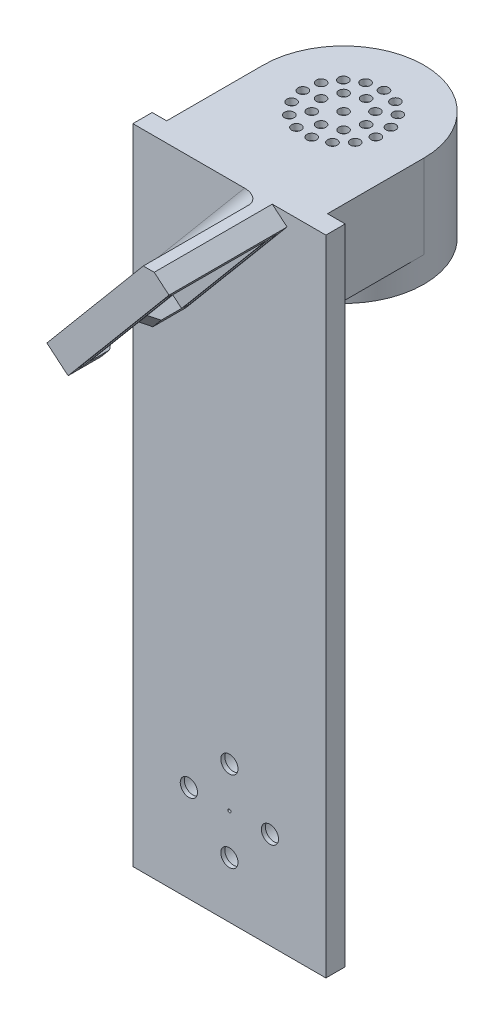
from build123d import *

# Parameters (mm, degrees)
SKETCH1_W                     = 38.1
SKETCH1_H                     = 3.81
MAIN_ARM_DEPTH                = 127
SKETCH2_R                     = 1.7
SKETCH2_R_2                   = 0.3175
CUT_EXTRUDE1_DEPTH            = 3.81
CBORE_FOR_M3_SHCS1_AT_2_COUNT = 2
CBORE_FOR_M3_SHCS1_AT_2_PITCH = 11.313708499
CBORE_FOR_M3_SHCS1_AT_3_COUNT = 2
CBORE_FOR_M3_SHCS1_AT_3_PITCH = 16
CBORE_FOR_M3_SHCS1_AT_4_COUNT = 2
CBORE_FOR_M3_SHCS1_AT_4_PITCH = 11.313708499
BOSS_EXTRUDE3_DEPTH           = 16.51
SKETCH9_R                     = 15.875
BOSS_EXTRUDE4_DEPTH           = 5.08
SKETCH11_R                    = 12.7
CUT_EXTRUDE2_DEPTH            = 20.32
SKETCH13_R                    = 0.9525
CUT_EXTRUDE3_DEPTH            = 1.27
THREAD1_PITCH                 = 2.208695608
BOSS_EXTRUDE5_DEPTH           = 23.3045
SKETCH15_W                    = 30.988
SKETCH15_H                    = 23.3045
SKETCH15_W_2                  = 25.908
SKETCH15_H_2                  = 18.2245
BOSS_EXTRUDE6_DEPTH           = 3.81
SKETCH16_W                    = 3.81
SKETCH16_H                    = 3.81
BOSS_EXTRUDE7_DEPTH           = 1.27
SKETCH17_R                    = 5.0165
CUT_EXTRUDE4_DEPTH            = 1.651
CUT_EXTRUDE5_DEPTH            = 2.54
CUT_EXTRUDE6_DEPTH            = 2.794
FILLET1_R                     = 2.54


with BuildPart() as part:
    # Sketch1 → main arm (new body)
    with BuildSketch(Plane(origin=(0, 0, 0), x_dir=(1, 0, 0), z_dir=(0, 1, 0))):
        with Locations((19.05, 1.905)):
            Rectangle(SKETCH1_W, SKETCH1_H)
    extrude(amount=MAIN_ARM_DEPTH)

    # Sketch2 → Cut-Extrude1 (cut)
    with BuildSketch(Plane.XY):
        with Locations((19.05, 27.05)):
            Circle(SKETCH2_R)
        with Locations((27.05, 19.05)):
            Circle(SKETCH2_R)
        with Locations((19.05, 11.05)):
            Circle(SKETCH2_R)
        with Locations((11.05, 19.05)):
            Circle(SKETCH2_R)
        with Locations((19.05, 19.05)):
            Circle(SKETCH2_R_2)
    extrude(amount=-CUT_EXTRUDE1_DEPTH, mode=Mode.SUBTRACT)

    # Sketch4 → CBORE for M3 SHCS1 (revolve, cut)
    with BuildSketch(Plane(origin=(19.05, 27.05, -3.81), x_dir=(0, 1, 0), z_dir=(1, 0, 0))):
        Polygon((0, 0), (0, 4.831463052), (1.7, 3.81), (1.7, 3), (3.25, 3), (3.25, 0.025), (3.275, 0), align=None)
    cbore_for_m3_shcs1 = revolve(axis=Axis((19.05, 27.05, -10.16), (0, 0, 1)), mode=Mode.SUBTRACT)

    # CBORE for M3 SHCS1 at 2: CBORE for M3 SHCS1 ×2
    with Locations(*[Vector(-0.7071067811865474, -0.7071067811865477, 0) * (i * CBORE_FOR_M3_SHCS1_AT_2_PITCH) for i in range(1, CBORE_FOR_M3_SHCS1_AT_2_COUNT)]):
        add(cbore_for_m3_shcs1, mode=Mode.SUBTRACT)

    # CBORE for M3 SHCS1 at 3: CBORE for M3 SHCS1 ×2
    with Locations(*[(0, -i * CBORE_FOR_M3_SHCS1_AT_3_PITCH, 0) for i in range(1, CBORE_FOR_M3_SHCS1_AT_3_COUNT)]):
        add(cbore_for_m3_shcs1, mode=Mode.SUBTRACT)

    # CBORE for M3 SHCS1 at 4: CBORE for M3 SHCS1 ×2
    with Locations(*[Vector(0.7071067811865474, -0.7071067811865477, 0) * (i * CBORE_FOR_M3_SHCS1_AT_4_PITCH) for i in range(1, CBORE_FOR_M3_SHCS1_AT_4_COUNT)]):
        add(cbore_for_m3_shcs1, mode=Mode.SUBTRACT)

    # Sketch8 → Boss-Extrude3 (add)
    with BuildSketch(Plane(origin=(0, 127, 0), x_dir=(1, 0, 0), z_dir=(0, 1, 0))):
        with BuildLine():
            Line((2.8575, 22.86), (2.8575, 3.81))
            Line((2.8575, 3.81), (34.6075, 3.81))
            Line((34.6075, 3.81), (34.6075, 22.86))
            ThreePointArc((34.6075, 22.86), (18.7325, 38.735), (2.8575, 22.86))
        make_face()
    extrude(amount=-BOSS_EXTRUDE3_DEPTH)

    # Sketch9 → Boss-Extrude4 (add)
    with BuildSketch(Plane.XZ.offset(-110.49)):
        with Locations((18.7325, -22.86)):
            Circle(SKETCH9_R)
    extrude(amount=BOSS_EXTRUDE4_DEPTH)

    # Sketch11 → Cut-Extrude2 (cut)
    with BuildSketch(Plane(origin=(65.591579687, 105.41, -4.236331947), x_dir=(-1, 0, 0), z_dir=(0, -1, 0))):
        with Locations(Location((46.859079687, 18.623668053, 0), (0, 0, 90))):
            Circle(SKETCH11_R)
    extrude(amount=-CUT_EXTRUDE2_DEPTH, mode=Mode.SUBTRACT)

    # Sketch13 → Cut-Extrude3 (cut)
    with BuildSketch(Plane(origin=(0, 127, 127), x_dir=(-1, 0, 0), z_dir=(0, -1, 0))):
        with Locations(Location((-18.7325, 154.305, 0), (0, 0, 90))):
            Circle(SKETCH13_R)
        with Locations(Location((-15.589410358, 153.003089642, 0), (0, 0, 90))):
            Circle(SKETCH13_R)
        with Locations(Location((-14.2875, 149.86, 0), (0, 0, 90))):
            Circle(SKETCH13_R)
        with Locations(Location((-15.589410358, 146.716910358, 0), (0, 0, 90))):
            Circle(SKETCH13_R)
        with Locations(Location((-18.7325, 145.415, 0), (0, 0, 90))):
            Circle(SKETCH13_R)
        with Locations(Location((-21.875589642, 146.716910358, 0), (0, 0, 90))):
            Circle(SKETCH13_R)
        with Locations(Location((-19.096895232, 157.47128216, 0), (0, 0, 90))):
            Circle(SKETCH13_R)
        with Locations(Location((-15.969604254, 156.961465137, 0), (0, 0, 90))):
            Circle(SKETCH13_R)
        with Locations(Location((-13.32004305, 155.223740278, 0), (0, 0, 90))):
            Circle(SKETCH13_R)
        with Locations(Location((-11.606344824, 152.558575996, 0), (0, 0, 90))):
            Circle(SKETCH13_R)
        with Locations(Location((-11.124823567, 149.426803409, 0), (0, 0, 90))):
            Circle(SKETCH13_R)
        with Locations(Location((-11.958738678, 146.369934448, 0), (0, 0, 90))):
            Circle(SKETCH13_R)
        with Locations(Location((-18.7325, 149.86, 0), (0, 0, 90))):
            Circle(SKETCH13_R)
        with Locations(Location((-13.96389866, 143.916529527, 0), (0, 0, 90))):
            Circle(SKETCH13_R)
        with Locations(Location((-16.793593135, 142.490804646, 0), (0, 0, 90))):
            Circle(SKETCH13_R)
        with Locations(Location((-19.958542221, 142.339280588, 0), (0, 0, 90))):
            Circle(SKETCH13_R)
        with Locations(Location((-22.911497469, 143.48815724, 0), (0, 0, 90))):
            Circle(SKETCH13_R)
        with Locations(Location((-25.14186609, 145.738783392, 0), (0, 0, 90))):
            Circle(SKETCH13_R)
        with Locations(Location((-26.263997086, 148.702005336, 0), (0, 0, 90))):
            Circle(SKETCH13_R)
        with Locations(Location((-26.083863815, 151.865455077, 0), (0, 0, 90))):
            Circle(SKETCH13_R)
        with Locations(Location((-24.632612955, 154.682143416, 0), (0, 0, 90))):
            Circle(SKETCH13_R)
        with Locations(Location((-22.161178964, 156.66503935, 0), (0, 0, 90))):
            Circle(SKETCH13_R)
        with Locations(Location((-23.1775, 149.86, 0), (0, 0, 90))):
            Circle(SKETCH13_R)
        with Locations(Location((-21.875589642, 153.003089642, 0), (0, 0, 90))):
            Circle(SKETCH13_R)
    extrude(amount=CUT_EXTRUDE3_DEPTH, mode=Mode.SUBTRACT)

    # Thread1: the profile of Thread Profile1 profile screwed along a right-hand helix of 8.625 turns, 10 arcs to a turn; built about Z, then put on its axis
    thread1_z = Axis((0, 0, 0), (0, 0, 1))
    thread1_corners = [(12.6997, 0, -0.000173205), (14.074815323, 0, 0.793749997), (14.074815323, 0, 1.111249997), (12.6997, 0, 1.905173198)]
    with BuildLine(mode=Mode.PRIVATE) as thread1_profile:
        Line(thread1_corners[0], thread1_corners[1])
        Line(thread1_corners[1], thread1_corners[2])
        Line(thread1_corners[2], thread1_corners[3])
        Line(thread1_corners[3], thread1_corners[0])
    thread1_cap = Face(thread1_profile.wire())
    thread1_turn_angles = [0, 18, 36, 54, 72, 90, 108, 126, 144, 162, 180, 198, 216, 234, 252, 270, 288, 306, 324, 342, 360]
    thread1_turn_weights = [1, 0.9510565162951535, 1, 0.9510565162951535, 1, 0.9510565162951535, 1, 0.9510565162951535, 1, 0.9510565162951535, 1, 0.9510565162951535, 1, 0.9510565162951535, 1, 0.9510565162951535, 1, 0.9510565162951535, 1, 0.9510565162951535, 1]
    thread1_turn_rails = [Edge.make_bspline([Vector(p[0], p[1], 0).rotate(thread1_z, thread1_turn_angles[k]) / thread1_turn_weights[k] + Vector(0, 0, p[2] + THREAD1_PITCH * thread1_turn_angles[k] / 360) for k in range(21)], [0, 0, 0, 1, 1, 2, 2, 3, 3, 4, 4, 5, 5, 6, 6, 7, 7, 8, 8, 9, 9, 10, 10, 10], 2, thread1_turn_weights) for p in thread1_corners]
    thread1_turn_sides = [Face.make_surface_from_curves(thread1_turn_rails[p[0]], thread1_turn_rails[p[1]]) for p in [(0, 1), (1, 2), (2, 3), (3, 0)]]
    thread1_last_angles = [2880, 2898, 2916, 2934, 2952, 2970, 2988, 3006, 3024, 3042, 3060, 3078, 3096, 3100.50003105, 3105.0000621]
    thread1_last_weights = [1, 0.9510565162951535, 1, 0.9510565162951535, 1, 0.9510565162951535, 1, 0.9510565162951535, 1, 0.9510565162951535, 1, 0.9510565162951535, 1, 0.9969172912140559, 1]
    thread1_last_rails = [Edge.make_bspline([Vector(p[0], p[1], 0).rotate(thread1_z, thread1_last_angles[k]) / thread1_last_weights[k] + Vector(0, 0, p[2] + THREAD1_PITCH * thread1_last_angles[k] / 360) for k in range(15)], [0, 0, 0, 1, 1, 2, 2, 3, 3, 4, 4, 5, 5, 6, 6, 7, 7, 7], 2, thread1_last_weights) for p in thread1_corners]
    thread1_last_sides = [Face.make_surface_from_curves(thread1_last_rails[p[0]], thread1_last_rails[p[1]]) for p in [(0, 1), (1, 2), (2, 3), (3, 0)]]
    thread1 = Plane(origin=(18.7325, 102.87, -22.86), x_dir=(1, 0, 0), z_dir=(0, 1, 0)) * Solid(Shell([*[p.moved(Location((0, 0, THREAD1_PITCH * i))) for i in range(8) for p in thread1_turn_sides], *thread1_last_sides, thread1_cap, thread1_cap.rotate(thread1_z, 3105.0000621).moved(Location((0, 0, THREAD1_PITCH * 3105.0000621 / 360)))]))
    add(thread1, mode=Mode.SUBTRACT)

    # Sketch14 → Boss-Extrude5 (add)
    with BuildSketch(Plane.XY):
        Polygon((25.36329169, 127), (6.335077301, 104.32305714), (7.599816676, 103.261814797), (27.518519125, 127), align=None)
    extrude(amount=BOSS_EXTRUDE5_DEPTH)

    # Sketch15 → Boss-Extrude6 (add)
    with BuildSketch(Plane(origin=(-46.386762405, 38.923115225, 0), x_dir=(0.6427876096865405, 0.7660444431189772, 0), z_dir=(0.7660444431189772, -0.6427876096865405, 0))):
        with Locations((99.482207407, 11.65225)):
            Rectangle(SKETCH15_W, SKETCH15_H)
        with Locations((99.482207407, 11.65225)):
            Rectangle(SKETCH15_W_2, SKETCH15_H_2, mode=Mode.SUBTRACT)
    extrude(amount=BOSS_EXTRUDE6_DEPTH)

    # Sketch16 → Boss-Extrude7 (add)
    with BuildSketch(Plane(origin=(-46.386762405, 38.923115225, 0), x_dir=(0.6427876096865405, 0.7660444431189772, 0), z_dir=(0.7660444431189772, -0.6427876096865405, 0))):
        with Locations((88.433207407, 18.8595)):
            Rectangle(SKETCH16_W, SKETCH16_H)
        with Locations((88.433207407, 4.445)):
            Rectangle(SKETCH16_W, SKETCH16_H)
        with Locations((110.531207407, 4.445)):
            Rectangle(SKETCH16_W, SKETCH16_H)
        with Locations((110.531207407, 18.8595)):
            Rectangle(SKETCH16_W, SKETCH16_H)
    extrude(amount=BOSS_EXTRUDE7_DEPTH)

    # Sketch17 → Cut-Extrude4 (cut)
    with BuildSketch(Plane(origin=(-46.386762405, 38.923115225, 0), x_dir=(0.6427876096865405, 0.7660444431189772, 0), z_dir=(0.7660444431189772, -0.6427876096865405, 0))):
        with Locations((99.482207407, 11.65225)):
            Circle(SKETCH17_R)
    extrude(amount=-CUT_EXTRUDE4_DEPTH, mode=Mode.SUBTRACT)

    # Sketch18 → Cut-Extrude5 (cut)
    with BuildSketch(Plane(origin=(53.986579081, 64.338699571, 0), x_dir=(0, 0, 1), z_dir=(-0.6427876096865401, -0.7660444431189775, 0))):
        Polygon((6.57225, 56.743617771), (16.73225, 56.743617771), (13.55725, 59.918617771), (9.74725, 59.918617771), align=None)
    extrude(amount=-CUT_EXTRUDE5_DEPTH, mode=Mode.SUBTRACT)

    # Sketch19 → Cut-Extrude6 (cut)
    with BuildSketch(Plane(origin=(-43.468133076, 36.474094432, 0), x_dir=(0, 0, -1), z_dir=(0.7660444431189769, -0.6427876096865407, 0))):
        with BuildLine():
            Line((-21.3995, 112.563207407), (-21.3995, 86.401207407))
            ThreePointArc((-21.3995, 86.401207407), (-22.0345, 85.766207407), (-22.6695, 86.401207407))
            Line((-22.6695, 86.401207407), (-22.6695, 112.563207407))
            ThreePointArc((-22.6695, 112.563207407), (-22.0345, 113.198207407), (-21.3995, 112.563207407))
        make_face()
        with BuildLine():
            Line((-0.635, 112.563207407), (-0.635, 86.401207407))
            ThreePointArc((-0.635, 86.401207407), (-1.27, 85.766207407), (-1.905, 86.401207407))
            Line((-1.905, 86.401207407), (-1.905, 112.563207407))
            ThreePointArc((-1.905, 112.563207407), (-1.27, 113.198207407), (-0.635, 112.563207407))
        make_face()
    extrude(amount=-CUT_EXTRUDE6_DEPTH, mode=Mode.SUBTRACT)

    # Fillet1
    fillet1_edges = [part.edges().sort_by_distance(p)[0] for p in [
        (15.849184496, 115.66152857, 0),
    ]]
    fillet(fillet1_edges, radius=FILLET1_R)


solid = part.part
